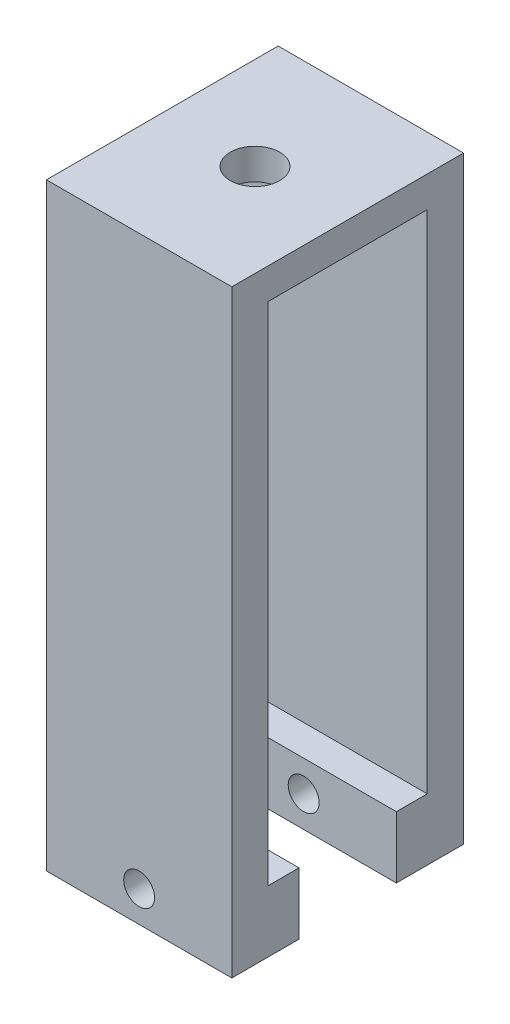
from build123d import *

# Parameters (mm, degrees)
ESQUISSE1_W             = 12
ESQUISSE1_H             = 38.75
BOSS_EXTRU_1_DEPTH      = 15
ENL_V_MAT_EXTRU_1_DEPTH = 44.25
ESQUISSE3_R             = 1
ENL_V_MAT_EXTRU_2_DEPTH = 42.982883417
ESQUISSE5_R             = 1.6
ENL_V_MAT_EXTRU_3_DEPTH = 41.144271073


with BuildPart() as part:
    # Esquisse1 → Boss.-Extru.1 (new body)
    with BuildSketch(Plane.XY):
        with Locations((0, 19.375)):
            Rectangle(ESQUISSE1_W, ESQUISSE1_H)
    extrude(amount=BOSS_EXTRU_1_DEPTH)

    # Esquisse2 → Enlèv. mat.-Extru.1 (cut, through all)
    with BuildSketch(Plane(origin=(6, 0, 0), x_dir=(0, 0, -1), z_dir=(1, 0, 0))):
        Polygon((-12.65, 36.75), (-2.35, 36.75), (-2.35, 4), (-4.35, 4), (-4.35, 0), (-10.65, 0), (-10.65, 4), (-12.65, 4), align=None)
    extrude(amount=-ENL_V_MAT_EXTRU_1_DEPTH, mode=Mode.SUBTRACT)

    # Esquisse3 → Enlèv. mat.-Extru.2 (cut, through all)
    with BuildSketch(Plane(origin=(0, 0, 0), x_dir=(-1, 0, 0), z_dir=(0, 0, -1))):
        with Locations((0, 2)):
            Circle(ESQUISSE3_R)
    extrude(amount=-ENL_V_MAT_EXTRU_2_DEPTH, mode=Mode.SUBTRACT)

    # Esquisse5 → Enlèv. mat.-Extru.3 (cut, through all)
    with BuildSketch(Plane.XZ.offset(-36.75)):
        with Locations((0, 7.5)):
            Circle(ESQUISSE5_R)
    extrude(amount=-ENL_V_MAT_EXTRU_3_DEPTH, mode=Mode.SUBTRACT)


solid = part.part
